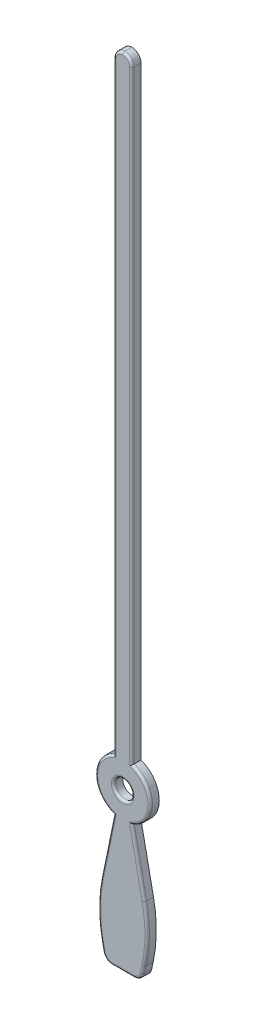
from build123d import *

# Parameters (mm, degrees)
SKETCH_1_R      = 0.6
SKETCH_1_R_2    = 0.2
EXTRUDE_1_DEPTH = 0.2
EXTRUDE_START   = -0.2
EXTRUDE_2_DEPTH = 0.2
FILLET_1_R      = 0.2
FILLET_2_R      = 0.05


with BuildPart() as part:
    # Эскиз1 → Бобышка-Вытянуть1 (new body)
    with BuildSketch(Plane.XY):
        Circle(SKETCH_1_R)
        Circle(SKETCH_1_R_2, mode=Mode.SUBTRACT)
    extrude(amount=EXTRUDE_1_DEPTH)

    # Эскиз3 → Бобышка-Вытянуть2 (add)
    with BuildSketch(Plane.XY.offset(0.2).offset(EXTRUDE_START)):
        with BuildLine():
            Line((-0.2, 0.565685425), (-0.2, 14))
            Line((-0.2, 14), (0.2, 14))
            Line((0.2, 14), (0.2, 0.565685425))
            ThreePointArc((0.2, 0.565685425), (0, 0.6), (-0.2, 0.565685425))
        make_face()
        with BuildLine():
            Line((-0.2, -0.565685425), (-0.473607186, -1.89863889))
            ThreePointArc((-0.473607186, -1.89863889), (-0.53485247, -2.514130031), (-0.468572045, -3.129099328))
            Line((-0.468572045, -3.129099328), (-0.4, -3.44981817))
            Line((-0.4, -3.44981817), (0.4, -3.44981817))
            Line((0.4, -3.44981817), (0.468572045, -3.129099328))
            ThreePointArc((0.468572045, -3.129099328), (0.53485247, -2.514130031), (0.473607186, -1.89863889))
            Line((0.473607186, -1.89863889), (0.2, -0.565685425))
            ThreePointArc((0.2, -0.565685425), (0, -0.6), (-0.2, -0.565685425))
        make_face()
    extrude(amount=EXTRUDE_2_DEPTH)

    # Скругление1
    fillet_1_edges = [part.edges().sort_by_distance(p)[0] for p in [
        (-0.4, -3.44981817, 0.1),
        (0.4, -3.44981817, 0.1),
        (-0.2, 14, 0.1),
        (0.2, 14, 0.1),
    ]]
    fillet(fillet_1_edges, radius=FILLET_1_R - 0.0001)  # a hair under: the kernel refuses the full size

    # Скругление2
    fillet_2_edges = [part.edges().sort_by_distance(p)[0] for p in [
        (0.2, 7.182892712, 0.2),
        (0.6, 0, 0.2),
        (-0.336803593, -1.232162158, 0.2),
        (-0.53485247, -2.514130031, 0.2),
        (-0.451187979, -3.210406476, 0.2),
        (0.53485247, -2.514130031, 0.2),
        (0.336803593, -1.232162158, 0.2),
        (0, -3.44981817, 0.2),
        (0.451187979, -3.210406476, 0.2),
        (-0.2, 7.182892712, 0.2),
        (0.364030264, -3.405344875, 0.2),
        (-0.364030264, -3.405344875, 0.2),
        (0.141450646, 13.941450646, 0.2),
        (-0.141450646, 13.941450646, 0.2),
        (-0.2, 0, 0.2),
        (-0.6, 0, 0.2),
    ]]
    fillet(fillet_2_edges, radius=FILLET_2_R)


solid = part.part
